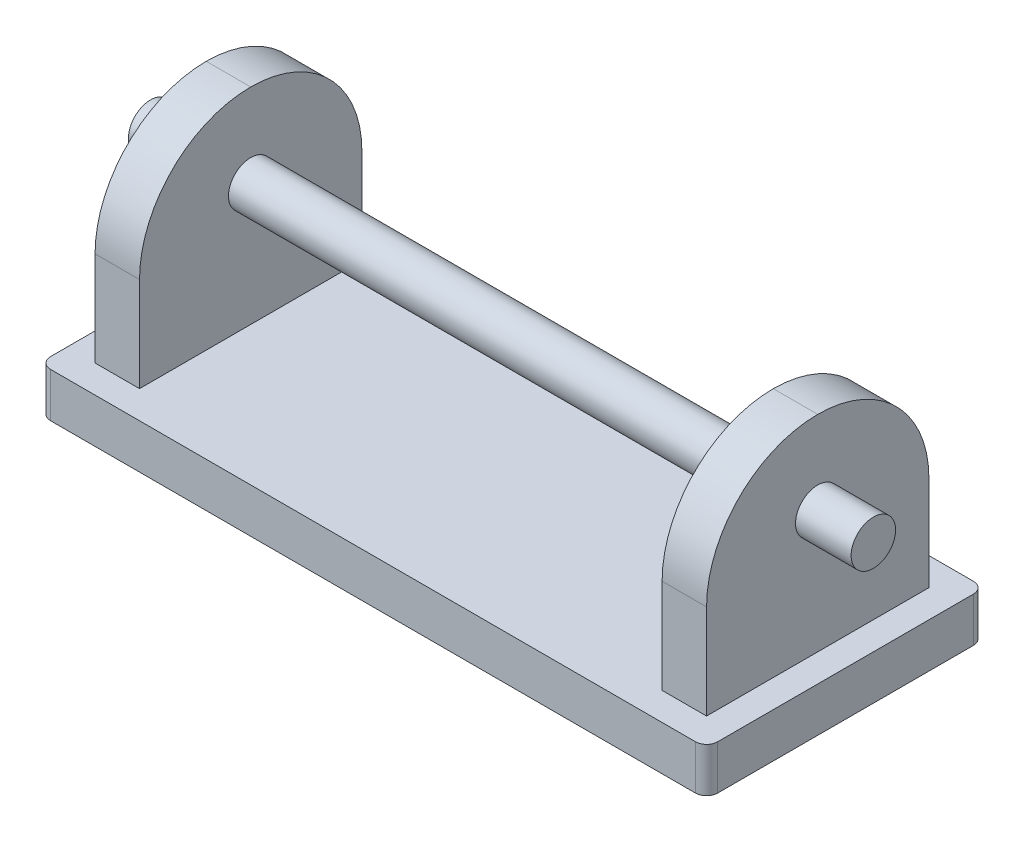
from build123d import *

# Parameters (mm, degrees)
SKETCH1_W                = 120
SKETCH1_H                = 50
BOSS_EXTRUDE1_DEPTH      = 8
SKETCH2_W                = 8
SKETCH2_H                = 40
BOSS_EXTRUDE2_DEPTH      = 37
FILLET1_R                = 20
BOSS_EXTRUDE3_DEPTH      = 10
BOSS_EXTRUDE3_DEPTH_BACK = 120
SKETCH3_R                = 4
FILLET2_R                = 2


with BuildPart() as part:
    # Sketch1 → Boss-Extrude1 (new body)
    with BuildSketch(Plane(origin=(0, 0, 0), x_dir=(1, 0, 0), z_dir=(0, 1, 0))):
        Rectangle(SKETCH1_W, SKETCH1_H)
    extrude(amount=BOSS_EXTRUDE1_DEPTH)

    # Sketch2 → Boss-Extrude2 (add)
    with BuildSketch(Plane(origin=(0, 8, 0), x_dir=(1, 0, 0), z_dir=(0, 1, 0))):
        with Locations((-51, 0)):
            Rectangle(SKETCH2_W, SKETCH2_H)
        with Locations((51, 0)):
            Rectangle(SKETCH2_W, SKETCH2_H)
    extrude(amount=BOSS_EXTRUDE2_DEPTH)

    # Fillet1
    fillet1_edges = [part.edges().sort_by_distance(p)[0] for p in [
        (51, 45, -20),
        (51, 45, 20),
        (-51, 45, -20),
        (-51, 45, 20),
    ]]
    fillet(fillet1_edges, radius=FILLET1_R - 0.0001)  # a hair under: the kernel refuses the full size

    # Sketch3 → Boss-Extrude3 (add, two sides: drawn at the far end of the back side and taken through both)
    with BuildSketch(Plane.ZY.offset(55).offset(-BOSS_EXTRUDE3_DEPTH_BACK)):
        with Locations((0, 30)):
            Circle(SKETCH3_R)
    extrude(amount=BOSS_EXTRUDE3_DEPTH + BOSS_EXTRUDE3_DEPTH_BACK)

    # Fillet2
    fillet2_edges = [part.edges().sort_by_distance(p)[0] for p in [
        (-60, 4, -25),
        (60, 4, -25),
        (60, 4, 25),
        (-60, 4, 25),
    ]]
    fillet(fillet2_edges, radius=FILLET2_R)


solid = part.part
